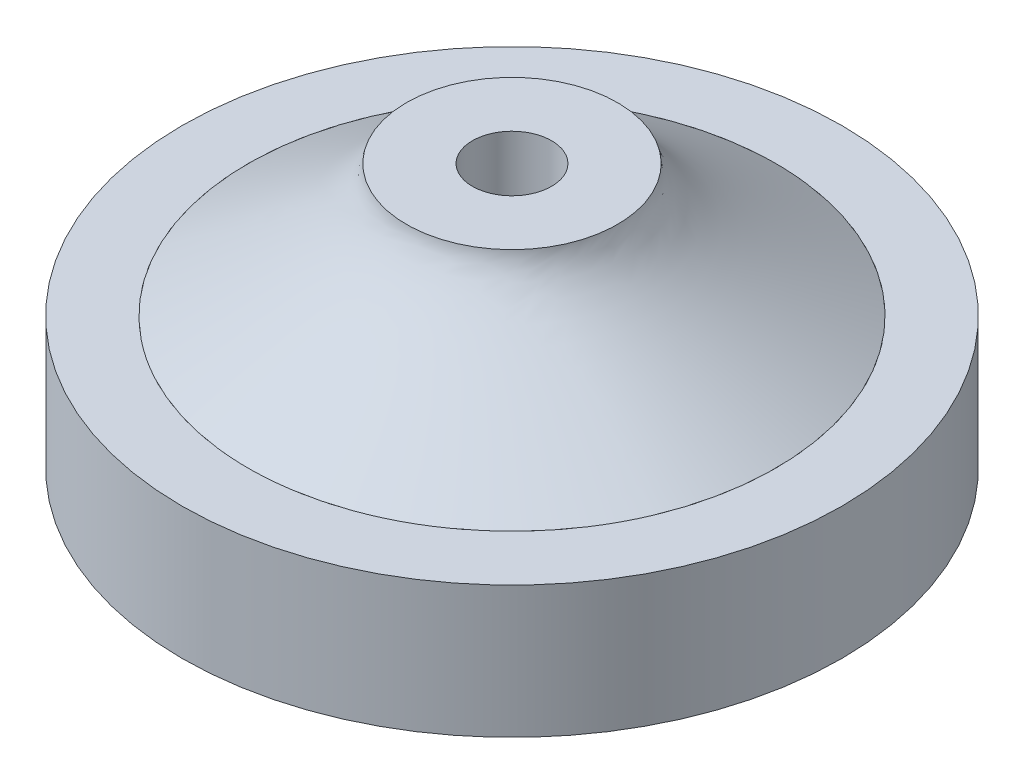
from build123d import *

# Parameters (mm, degrees)
SKETCH2_R                = 10
BOSS_EXTRUDE1_DEPTH      = 3
SKETCH4_R                = 1.5
CUT_EXTRUDE1_DEPTH       = 5
BOSS_EXTRUDE2_DEPTH      = 2
BOSS_EXTRUDE2_DEPTH_BACK = 3
SKETCH6_R                = 12.5
SKETCH6_R_2              = 10


with BuildPart() as part:
    # Sketch2 → Boss-Extrude1 (new body)
    with BuildSketch(Plane(origin=(0, 0, 0), x_dir=(1, 0, 0), z_dir=(0, 1, 0))):
        with Locations(Location((0, 0, 0), (0, 0, 270))):
            Circle(SKETCH2_R)
    extrude(amount=BOSS_EXTRUDE1_DEPTH)

    # Loft1: read off the stored shape, not the designer's step
    # Loft1: loft between two sections, ruled curve by curve
    loft1_from = [
        Edge.make_bspline([(-3.890065626, 8, -0.931337439), (-2.027390748, 8, -8.711468691), (5.752740504, 8, -6.848793813), (3.890065626, 8, 0.931337439), (2.027390748, 8, 8.711468691), (-5.752740504, 8, 6.848793813), (-3.890065626, 8, -0.931337439)], [0, 0, 0, 0, 0.5, 0.5, 0.5, 1, 1, 1, 1], 3, [1, 0.333333333, 0.333333333, 1, 0.333333333, 0.333333333, 1]),
    ]
    loft1_to = [
        Edge.make_bspline([(-2.462547893, 3, -9.692051273), (16.921554653, 3, -14.617147059), (21.846650439, 3, 4.766955487), (2.462547893, 3, 9.692051273), (-16.921554653, 3, 14.617147059), (-21.846650439, 3, -4.766955487), (-2.462547893, 3, -9.692051273)], [0, 0, 0, 0, 0.5, 0.5, 0.5, 1, 1, 1, 1], 3, [1, 0.333333333, 0.333333333, 1, 0.333333333, 0.333333333, 1]),
    ]
    loft1 = Solid(Shell([*[Face.make_surface_from_curves(loft1_from[k], loft1_to[k]) for k in range(1)], Face(Wire(loft1_from)), Face(Wire(loft1_to))]))
    add(loft1)

    # Sketch4 → Cut-Extrude1 (cut)
    with BuildSketch(Plane(origin=(0, 8, 0), x_dir=(1, 0, 0), z_dir=(0, 1, 0))):
        with Locations(Location((0, 0, 0), (0, 0, 270))):
            Circle(SKETCH4_R)
    extrude(amount=-CUT_EXTRUDE1_DEPTH, mode=Mode.SUBTRACT)


with BuildPart() as body_2:
    # Sketch6 → Boss-Extrude2 (new, two sides: drawn at the far end of the back side and taken through both)
    with BuildSketch(Plane.XZ.offset(-BOSS_EXTRUDE2_DEPTH_BACK)):
        with Locations(Location((0, 0, 0), (0, 0, 270))):
            Circle(SKETCH6_R)
        with Locations(Location((0, 0, 0), (0, 0, 270))):
            Circle(SKETCH6_R_2, mode=Mode.SUBTRACT)
    extrude(amount=BOSS_EXTRUDE2_DEPTH + BOSS_EXTRUDE2_DEPTH_BACK)


solid = Compound([part.part, body_2.part])
